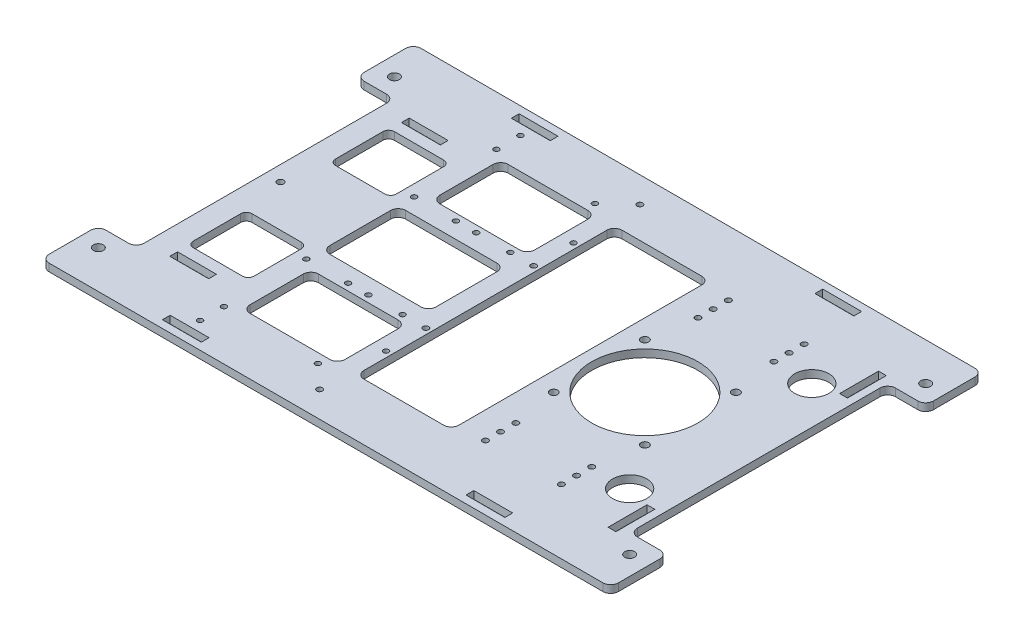
from build123d import *

# Parameters (mm, degrees)
SKETCH_1_R             = 28
SKETCH_1_R_2           = 2.6
SM_BASE_FLANGE_1_DEPTH = 4
CUT_EXTRUDE_1_REACH    = 360.374
SKETCH_6_W             = 4.1
SKETCH_6_H             = 20.5
SKETCH_6_W_2           = 20.5
SKETCH_6_H_2           = 4.1
CUT_EXTRUDE_2_REACH    = 360.374
SKETCH_7_R             = 2.05
SKETCH_14_R            = 1.4
SKETCH_14_R_2          = 1.494707745
SKETCH_14_R_3          = 1.476153091
SKETCH_14_R_4          = 1.75
CUT_EXTRUDE_3_DEPTH    = 359.374106207
SKETCH_15_R            = 1.5
SKETCH_15_R_2          = 9
CUT_EXTRUDE_4_DEPTH    = 359.374106207


# Sheet-metal steps are written as plain solids
with BuildPart() as part:
    # Sketch 1 → Базовая кромка1 (new body)
    with BuildSketch(Plane(origin=(0, 0, 0), x_dir=(1, 0, 0), z_dir=(0, 1, 0))):
        with BuildLine():
            Line((0, -170.108474074), (0, -191.891525926))
            ThreePointArc((0, -191.891525926), (1.203344196, -194.796655804), (4.108474074, -196))
            Line((4.108474074, -196), (295.891525926, -196))
            ThreePointArc((295.891525926, -196), (298.796655804, -194.796655804), (300, -191.891525926))
            Line((300, -191.891525926), (300, -170.108474074))
            ThreePointArc((300, -170.108474074), (298.796655804, -167.203344196), (295.891525926, -166))
            Line((295.891525926, -166), (284.108474074, -166))
            ThreePointArc((284.108474074, -166), (281.203344196, -164.796655804), (280, -161.891525926))
            Line((280, -161.891525926), (280, -34.108474074))
            ThreePointArc((280, -34.108474074), (281.203344196, -31.203344196), (284.108474074, -30))
            Line((284.108474074, -30), (295.891525926, -30))
            ThreePointArc((295.891525926, -30), (298.796655804, -28.796655804), (300, -25.891525926))
            Line((300, -25.891525926), (300, -4.108474074))
            ThreePointArc((300, -4.108474074), (298.796655804, -1.203344196), (295.891525926, 0))
            Line((295.891525926, 0), (4.108474074, 0))
            ThreePointArc((4.108474074, 0), (1.203344196, -1.203344196), (0, -4.108474074))
            Line((0, -4.108474074), (0, -25.891525926))
            ThreePointArc((0, -25.891525926), (1.203344196, -28.796655804), (4.108474074, -30))
            Line((4.108474074, -30), (15.891525926, -30))
            ThreePointArc((15.891525926, -30), (18.796655804, -31.203344196), (20, -34.108474074))
            Line((20, -34.108474074), (20, -161.891525926))
            ThreePointArc((20, -161.891525926), (18.796655804, -164.796655804), (15.891525926, -166))
            Line((15.891525926, -166), (4.108474074, -166))
            ThreePointArc((4.108474074, -166), (1.203344196, -167.203344196), (0, -170.108474074))
        make_face()
        with Locations(Location((220, -98, 0), (0, 0, 270))):
            Circle(SKETCH_1_R, mode=Mode.SUBTRACT)
        with Locations(Location((10, -20, 0), (0, 0, 270))):
            Circle(SKETCH_1_R_2, mode=Mode.SUBTRACT)
        with Locations(Location((290, -20, 0), (0, 0, 270))):
            Circle(SKETCH_1_R_2, mode=Mode.SUBTRACT)
        with Locations(Location((290, -176, 0), (0, 0, 90))):
            Circle(SKETCH_1_R_2, mode=Mode.SUBTRACT)
        with Locations(Location((10, -176, 0), (0, 0, 90))):
            Circle(SKETCH_1_R_2, mode=Mode.SUBTRACT)
    extrude(amount=-SM_BASE_FLANGE_1_DEPTH)

    # Эскиз6 → Вырез-Вытянуть1 (cut, up to next)
    with BuildSketch(Plane(origin=(0, 0, 0), x_dir=(1, 0, 0), z_dir=(0, 1, 0)), mode=Mode.PRIVATE) as cut_extrude_1_sk1:
        with Locations((273.95, -37)):
            Rectangle(SKETCH_6_W, SKETCH_6_H)
    cut_extrude_1_tool1 = extrude(cut_extrude_1_sk1.sketch, amount=-CUT_EXTRUDE_1_REACH, mode=Mode.PRIVATE) & part.part
    # Эскиз6 → Вырез-Вытянуть1 (cut, up to next)
    with BuildSketch(Plane(origin=(0, 0, 0), x_dir=(1, 0, 0), z_dir=(0, 1, 0)), mode=Mode.PRIVATE) as cut_extrude_1_sk2:
        with Locations((230, -6.05)):
            Rectangle(SKETCH_6_W_2, SKETCH_6_H_2)
    cut_extrude_1_tool2 = extrude(cut_extrude_1_sk2.sketch, amount=-CUT_EXTRUDE_1_REACH, mode=Mode.PRIVATE) & part.part
    # Эскиз6 → Вырез-Вытянуть1 (cut, up to next)
    with BuildSketch(Plane(origin=(0, 0, 0), x_dir=(1, 0, 0), z_dir=(0, 1, 0)), mode=Mode.PRIVATE) as cut_extrude_1_sk3:
        with Locations((70, -6.05)):
            Rectangle(SKETCH_6_W_2, SKETCH_6_H_2)
    cut_extrude_1_tool3 = extrude(cut_extrude_1_sk3.sketch, amount=-CUT_EXTRUDE_1_REACH, mode=Mode.PRIVATE) & part.part
    # Эскиз6 → Вырез-Вытянуть1 (cut, up to next)
    with BuildSketch(Plane(origin=(0, 0, 0), x_dir=(1, 0, 0), z_dir=(0, 1, 0)), mode=Mode.PRIVATE) as cut_extrude_1_sk4:
        with Locations((43, -36.95)):
            Rectangle(SKETCH_6_W_2, SKETCH_6_H_2)
    cut_extrude_1_tool4 = extrude(cut_extrude_1_sk4.sketch, amount=-CUT_EXTRUDE_1_REACH, mode=Mode.PRIVATE) & part.part
    # Эскиз6 → Вырез-Вытянуть1 (cut, up to next)
    with BuildSketch(Plane(origin=(0, 0, 0), x_dir=(1, 0, 0), z_dir=(0, 1, 0)), mode=Mode.PRIVATE) as cut_extrude_1_sk5:
        with Locations((43, -159.05)):
            Rectangle(SKETCH_6_W_2, SKETCH_6_H_2)
    cut_extrude_1_tool5 = extrude(cut_extrude_1_sk5.sketch, amount=-CUT_EXTRUDE_1_REACH, mode=Mode.PRIVATE) & part.part
    # Эскиз6 → Вырез-Вытянуть1 (cut, up to next)
    with BuildSketch(Plane(origin=(0, 0, 0), x_dir=(1, 0, 0), z_dir=(0, 1, 0)), mode=Mode.PRIVATE) as cut_extrude_1_sk6:
        with Locations((70, -189.95)):
            Rectangle(SKETCH_6_W_2, SKETCH_6_H_2)
    cut_extrude_1_tool6 = extrude(cut_extrude_1_sk6.sketch, amount=-CUT_EXTRUDE_1_REACH, mode=Mode.PRIVATE) & part.part
    # Эскиз6 → Вырез-Вытянуть1 (cut, up to next)
    with BuildSketch(Plane(origin=(0, 0, 0), x_dir=(1, 0, 0), z_dir=(0, 1, 0)), mode=Mode.PRIVATE) as cut_extrude_1_sk7:
        with Locations((230, -189.95)):
            Rectangle(SKETCH_6_W_2, SKETCH_6_H_2)
    cut_extrude_1_tool7 = extrude(cut_extrude_1_sk7.sketch, amount=-CUT_EXTRUDE_1_REACH, mode=Mode.PRIVATE) & part.part
    # Эскиз6 → Вырез-Вытянуть1 (cut, up to next)
    with BuildSketch(Plane(origin=(0, 0, 0), x_dir=(1, 0, 0), z_dir=(0, 1, 0)), mode=Mode.PRIVATE) as cut_extrude_1_sk8:
        with Locations((273.95, -159)):
            Rectangle(SKETCH_6_W, SKETCH_6_H)
    cut_extrude_1_tool8 = extrude(cut_extrude_1_sk8.sketch, amount=-CUT_EXTRUDE_1_REACH, mode=Mode.PRIVATE) & part.part
    add(cut_extrude_1_tool1.solids().sort_by_distance((273.95, 0, 37))[0], mode=Mode.SUBTRACT)
    add(cut_extrude_1_tool2.solids().sort_by_distance((230, 0, 6.05))[0], mode=Mode.SUBTRACT)
    add(cut_extrude_1_tool3.solids().sort_by_distance((70, 0, 6.05))[0], mode=Mode.SUBTRACT)
    add(cut_extrude_1_tool4.solids().sort_by_distance((43, 0, 36.95))[0], mode=Mode.SUBTRACT)
    add(cut_extrude_1_tool5.solids().sort_by_distance((43, 0, 159.05))[0], mode=Mode.SUBTRACT)
    add(cut_extrude_1_tool6.solids().sort_by_distance((70, 0, 189.95))[0], mode=Mode.SUBTRACT)
    add(cut_extrude_1_tool7.solids().sort_by_distance((230, 0, 189.95))[0], mode=Mode.SUBTRACT)
    add(cut_extrude_1_tool8.solids().sort_by_distance((273.95, 0, 159))[0], mode=Mode.SUBTRACT)

    # Эскиз7 → Вырез-Вытянуть2 (cut, up to next)
    with BuildSketch(Plane(origin=(0, 0, 0), x_dir=(1, 0, 0), z_dir=(0, 1, 0)), mode=Mode.PRIVATE) as cut_extrude_2_sk1:
        with Locations(Location((196, -74, 0), (0, 0, 270))):
            Circle(SKETCH_7_R)
    cut_extrude_2_tool1 = extrude(cut_extrude_2_sk1.sketch, amount=-CUT_EXTRUDE_2_REACH, mode=Mode.PRIVATE) & part.part
    # Эскиз7 → Вырез-Вытянуть2 (cut, up to next)
    with BuildSketch(Plane(origin=(0, 0, 0), x_dir=(1, 0, 0), z_dir=(0, 1, 0)), mode=Mode.PRIVATE) as cut_extrude_2_sk2:
        with Locations(Location((244, -74, 0), (0, 0, 270))):
            Circle(SKETCH_7_R)
    cut_extrude_2_tool2 = extrude(cut_extrude_2_sk2.sketch, amount=-CUT_EXTRUDE_2_REACH, mode=Mode.PRIVATE) & part.part
    # Эскиз7 → Вырез-Вытянуть2 (cut, up to next)
    with BuildSketch(Plane(origin=(0, 0, 0), x_dir=(1, 0, 0), z_dir=(0, 1, 0)), mode=Mode.PRIVATE) as cut_extrude_2_sk3:
        with Locations(Location((244, -122, 0), (0, 0, 270))):
            Circle(SKETCH_7_R)
    cut_extrude_2_tool3 = extrude(cut_extrude_2_sk3.sketch, amount=-CUT_EXTRUDE_2_REACH, mode=Mode.PRIVATE) & part.part
    # Эскиз7 → Вырез-Вытянуть2 (cut, up to next)
    with BuildSketch(Plane(origin=(0, 0, 0), x_dir=(1, 0, 0), z_dir=(0, 1, 0)), mode=Mode.PRIVATE) as cut_extrude_2_sk4:
        with Locations(Location((196, -122, 0), (0, 0, 270))):
            Circle(SKETCH_7_R)
    cut_extrude_2_tool4 = extrude(cut_extrude_2_sk4.sketch, amount=-CUT_EXTRUDE_2_REACH, mode=Mode.PRIVATE) & part.part
    # Эскиз7 → Вырез-Вытянуть2 (cut, up to next)
    with BuildSketch(Plane(origin=(0, 0, 0), x_dir=(1, 0, 0), z_dir=(0, 1, 0)), mode=Mode.PRIVATE) as cut_extrude_2_sk5:
        with BuildLine():
            Line((140, -30), (182, -30))
            ThreePointArc((182, -30), (184.828427125, -31.171572875), (186, -34))
            Line((186, -34), (186, -162))
            ThreePointArc((186, -162), (184.828427125, -164.828427125), (182, -166))
            Line((182, -166), (140, -166))
            ThreePointArc((140, -166), (137.171572875, -164.828427125), (136, -162))
            Line((136, -162), (136, -34))
            ThreePointArc((136, -34), (137.171572875, -31.171572875), (140, -30))
        make_face()
    cut_extrude_2_tool5 = extrude(cut_extrude_2_sk5.sketch, amount=-CUT_EXTRUDE_2_REACH, mode=Mode.PRIVATE) & part.part
    # Эскиз7 → Вырез-Вытянуть2 (cut, up to next)
    with BuildSketch(Plane(origin=(0, 0, 0), x_dir=(1, 0, 0), z_dir=(0, 1, 0)), mode=Mode.PRIVATE) as cut_extrude_2_sk6:
        with BuildLine():
            Line((74, -78), (122, -78))
            ThreePointArc((122, -78), (124.828427125, -79.171572875), (126, -82))
            Line((126, -82), (126, -114))
            ThreePointArc((126, -114), (124.828427125, -116.828427125), (122, -118))
            Line((122, -118), (74, -118))
            ThreePointArc((74, -118), (71.171572875, -116.828427125), (70, -114))
            Line((70, -114), (70, -82))
            ThreePointArc((70, -82), (71.171572875, -79.171572875), (74, -78))
        make_face()
    cut_extrude_2_tool6 = extrude(cut_extrude_2_sk6.sketch, amount=-CUT_EXTRUDE_2_REACH, mode=Mode.PRIVATE) & part.part
    # Эскиз7 → Вырез-Вытянуть2 (cut, up to next)
    with BuildSketch(Plane(origin=(0, 0, 0), x_dir=(1, 0, 0), z_dir=(0, 1, 0)), mode=Mode.PRIVATE) as cut_extrude_2_sk7:
        with BuildLine():
            Line((35, -45), (61, -45))
            ThreePointArc((61, -45), (63.121320344, -45.878679656), (64, -48))
            Line((64, -48), (64, -73))
            ThreePointArc((64, -73), (63.121320344, -75.121320344), (61, -76))
            Line((61, -76), (35, -76))
            ThreePointArc((35, -76), (32.878679656, -75.121320344), (32, -73))
            Line((32, -73), (32, -48))
            ThreePointArc((32, -48), (32.878679656, -45.878679656), (35, -45))
        make_face()
    cut_extrude_2_tool7 = extrude(cut_extrude_2_sk7.sketch, amount=-CUT_EXTRUDE_2_REACH, mode=Mode.PRIVATE) & part.part
    # Эскиз7 → Вырез-Вытянуть2 (cut, up to next)
    with BuildSketch(Plane(origin=(0, 0, 0), x_dir=(1, 0, 0), z_dir=(0, 1, 0)), mode=Mode.PRIVATE) as cut_extrude_2_sk8:
        with BuildLine():
            Line((64, -148), (64, -123))
            ThreePointArc((64, -123), (63.121320344, -120.878679656), (61, -120))
            Line((61, -120), (35, -120))
            ThreePointArc((35, -120), (32.878679656, -120.878679656), (32, -123))
            Line((32, -123), (32, -148))
            ThreePointArc((32, -148), (32.878679656, -150.121320344), (35, -151))
            Line((35, -151), (61, -151))
            ThreePointArc((61, -151), (63.121320344, -150.121320344), (64, -148))
        make_face()
    cut_extrude_2_tool8 = extrude(cut_extrude_2_sk8.sketch, amount=-CUT_EXTRUDE_2_REACH, mode=Mode.PRIVATE) & part.part
    add(cut_extrude_2_tool1.solids().sort_by_distance((196, 0, 74))[0], mode=Mode.SUBTRACT)
    add(cut_extrude_2_tool2.solids().sort_by_distance((244, 0, 74))[0], mode=Mode.SUBTRACT)
    add(cut_extrude_2_tool3.solids().sort_by_distance((244, 0, 122))[0], mode=Mode.SUBTRACT)
    add(cut_extrude_2_tool4.solids().sort_by_distance((196, 0, 122))[0], mode=Mode.SUBTRACT)
    add(cut_extrude_2_tool5.solids().sort_by_distance((161, 0, 98))[0], mode=Mode.SUBTRACT)
    add(cut_extrude_2_tool6.solids().sort_by_distance((98, 0, 98))[0], mode=Mode.SUBTRACT)
    add(cut_extrude_2_tool7.solids().sort_by_distance((48, 0, 60.5))[0], mode=Mode.SUBTRACT)
    add(cut_extrude_2_tool8.solids().sort_by_distance((48, 0, 135.5))[0], mode=Mode.SUBTRACT)

    # Эскиз14 → Вырез-Вытянуть3 (cut, through all)
    with BuildSketch(Plane(origin=(0, 0, 0), x_dir=(1, 0, 0), z_dir=(0, 1, 0))):
        with Locations(Location((70, -26.2, 0), (0, 0, 270))):
            Circle(SKETCH_14_R)
        with Locations(Location((120.7, -25, 0), (0, 0, 270))):
            Circle(SKETCH_14_R)
        with Locations(Location((70, -69.6, 0), (0, 0, 270))):
            Circle(SKETCH_14_R)
        with Locations(Location((120.7, -69.6, 0), (0, 0, 270))):
            Circle(SKETCH_14_R)
        with Locations(Location((70, -13.6, 0), (0, 0, 270))):
            Circle(SKETCH_14_R)
        with Locations(Location((133, -13.6, 0), (0, 0, 270))):
            Circle(SKETCH_14_R_2)
        with Locations(Location((133, -69.6, 0), (0, 0, 270))):
            Circle(SKETCH_14_R_3)
        with Locations(Location((133, -126.4, 0), (0, 0, 90))):
            Circle(SKETCH_14_R_3)
        with Locations(Location((133, -182.4, 0), (0, 0, 90))):
            Circle(SKETCH_14_R_2)
        with Locations(Location((70, -182.4, 0), (0, 0, 90))):
            Circle(SKETCH_14_R)
        with Locations(Location((120.7, -126.4, 0), (0, 0, 90))):
            Circle(SKETCH_14_R)
        with Locations(Location((70, -126.4, 0), (0, 0, 90))):
            Circle(SKETCH_14_R)
        with Locations(Location((120.7, -171, 0), (0, 0, 90))):
            Circle(SKETCH_14_R)
        with Locations(Location((70, -169.8, 0), (0, 0, 90))):
            Circle(SKETCH_14_R)
        with Locations(Location((133, -48.6, 0), (0, 0, 270))):
            Circle(SKETCH_14_R)
        with Locations(Location((92, -69.6, 0), (0, 0, 270))):
            Circle(SKETCH_14_R)
        with Locations((61.7, -48.6)):
            Circle(SKETCH_14_R)
        with Locations(Location((102.7, -69.6, 0), (0, 0, 270))):
            Circle(SKETCH_14_R)
        with Locations(Location((102.7, -126.4, 0), (0, 0, 90))):
            Circle(SKETCH_14_R)
        with Locations(Location((92, -126.4, 0), (0, 0, 90))):
            Circle(SKETCH_14_R)
        with Locations(Location((133, -147.4, 0), (0, 0, 90))):
            Circle(SKETCH_14_R)
        with Locations((61.7, -147.4)):
            Circle(SKETCH_14_R)
        with Locations(Location((28, -98, 0), (0, 0, 270))):
            Circle(SKETCH_14_R_4)
        with BuildLine():
            Line((80, -30), (122, -30))
            ThreePointArc((122, -30), (124.828427125, -31.171572875), (126, -34))
            Line((126, -34), (126, -62))
            ThreePointArc((126, -62), (124.828427125, -64.828427125), (122, -66))
            Line((122, -66), (80, -66))
            ThreePointArc((80, -66), (77.171572875, -64.828427125), (76, -62))
            Line((76, -62), (76, -34))
            ThreePointArc((76, -34), (77.171572875, -31.171572875), (80, -30))
        make_face()
        with BuildLine():
            Line((126, -162), (126, -134))
            ThreePointArc((126, -134), (124.828427125, -131.171572875), (122, -130))
            Line((122, -130), (80, -130))
            ThreePointArc((80, -130), (77.171572875, -131.171572875), (76, -134))
            Line((76, -134), (76, -162))
            ThreePointArc((76, -162), (77.171572875, -164.828427125), (80, -166))
            Line((80, -166), (122, -166))
            ThreePointArc((122, -166), (124.828427125, -164.828427125), (126, -162))
        make_face()
    extrude(amount=-CUT_EXTRUDE_3_DEPTH, mode=Mode.SUBTRACT)

    # Эскиз15 → Вырез-Вытянуть4 (cut, through all)
    with BuildSketch(Plane(origin=(0, 0, 0), x_dir=(1, 0, 0), z_dir=(0, 1, 0))):
        with Locations(Location((200, -34, 0), (0, 0, 270))):
            Circle(SKETCH_15_R)
        with Locations(Location((240, -34, 0), (0, 0, 270))):
            Circle(SKETCH_15_R)
        with Locations(Location((240, -42, 0), (0, 0, 270))):
            Circle(SKETCH_15_R)
        with Locations(Location((240, -50, 0), (0, 0, 270))):
            Circle(SKETCH_15_R)
        with Locations(Location((200, -42, 0), (0, 0, 270))):
            Circle(SKETCH_15_R)
        with Locations(Location((200, -50, 0), (0, 0, 270))):
            Circle(SKETCH_15_R)
        with Locations(Location((200, -146, 0), (0, 0, 90))):
            Circle(SKETCH_15_R)
        with Locations(Location((200, -154, 0), (0, 0, 90))):
            Circle(SKETCH_15_R)
        with Locations(Location((240, -146, 0), (0, 0, 90))):
            Circle(SKETCH_15_R)
        with Locations(Location((240, -154, 0), (0, 0, 90))):
            Circle(SKETCH_15_R)
        with Locations(Location((240, -162, 0), (0, 0, 90))):
            Circle(SKETCH_15_R)
        with Locations(Location((200, -162, 0), (0, 0, 90))):
            Circle(SKETCH_15_R)
        with Locations(Location((260, -50, 0), (0, 0, 270))):
            Circle(SKETCH_15_R_2)
        with Locations(Location((260, -146, 0), (0, 0, 90))):
            Circle(SKETCH_15_R_2)
    extrude(amount=-CUT_EXTRUDE_4_DEPTH, mode=Mode.SUBTRACT)


solid = part.part
